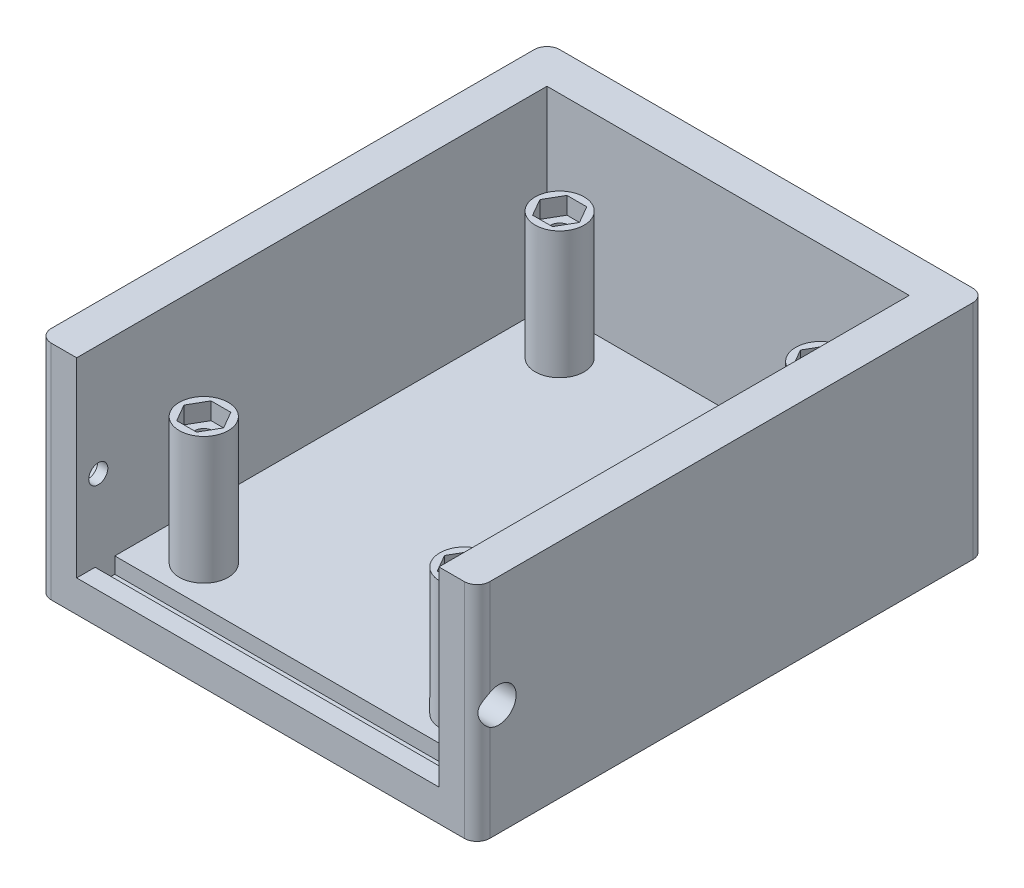
from build123d import *

# Parameters (mm, degrees)
SKETCH1_W                                = 65
SKETCH1_H                                = 80
BOSS_EXTRUDE1_DEPTH                      = 5
SKETCH2_W                                = 65
SKETCH2_H                                = 80
SKETCH2_W_2                              = 57
SKETCH2_H_2                              = 68
BOSS_EXTRUDE2_DEPTH                      = 30
SKETCH3_R                                = 3.85
BOSS_EXTRUDE3_DEPTH                      = 20
F_3_0MM_DOWEL_HOLE1_D                    = 3
F_3_0MM_DOWEL_HOLE1_DEPTH                = 8.5
F_3_0MM_DOWEL_HOLE1_CSINK_D              = 3.05
F_3_0MM_DOWEL_HOLE1_CSINK_ANGLE          = 90
F_3_0MM_DOWEL_HOLE1_TIP                  = 0.901290929
CUT_EXTRUDE1_DEPTH                       = 2.7
MIRROR1_AT_THE_SECOND_PLANE_COPY_1_DEPTH = 2.7
SKETCH13_R                               = 2.75
CUT_EXTRUDE4_DEPTH                       = 2.4
SKETCH14_R                               = 1.5
CUT_EXTRUDE5_DEPTH                       = 4
SKETCH11_W                               = 57
SKETCH11_H                               = 6
CUT_EXTRUDE2_DEPTH                       = 30
SKETCH15_W                               = 57
SKETCH15_H                               = 3.1
CUT_EXTRUDE6_DEPTH                       = 2.5
SKETCH16_W                               = 80
SKETCH16_H                               = 35
SKETCH16_R                               = 2.75
BOSS_EXTRUDE4_DEPTH                      = 2
FILLET1_R                                = 2


with BuildPart() as part:
    # Sketch1 → Boss-Extrude1 (new body)
    with BuildSketch(Plane(origin=(0, 0, 0), x_dir=(1, 0, 0), z_dir=(0, 1, 0))):
        Rectangle(SKETCH1_W, SKETCH1_H)
    extrude(amount=BOSS_EXTRUDE1_DEPTH)

    # Sketch2 → Boss-Extrude2 (add)
    with BuildSketch(Plane(origin=(0, 5, 0), x_dir=(1, 0, 0), z_dir=(0, 1, 0))):
        Rectangle(SKETCH2_W, SKETCH2_H)
        Rectangle(SKETCH2_W_2, SKETCH2_H_2, mode=Mode.SUBTRACT)
    extrude(amount=BOSS_EXTRUDE2_DEPTH)

    # Sketch3 → Boss-Extrude3 (add)
    with BuildSketch(Plane(origin=(0, 5, 0), x_dir=(1, 0, 0), z_dir=(0, 1, 0))):
        with Locations(Location((-20.5, -28, 0), (0, 0, 90))):
            Circle(SKETCH3_R)
        with Locations(Location((20.5, -28, 0), (0, 0, 90))):
            Circle(SKETCH3_R)
        with Locations(Location((20.5, 28, 0), (0, 0, 90))):
            Circle(SKETCH3_R)
        with Locations(Location((-20.5, 28, 0), (0, 0, 90))):
            Circle(SKETCH3_R)
    extrude(amount=BOSS_EXTRUDE3_DEPTH)

    # Ø3.0mm Dowel Hole1
    with Locations(Plane(origin=(0, 25, 0), x_dir=(1, 0, 0), z_dir=(0, 1, 0))):
        with Locations((-20.5, 28), (20.5, 28), (20.5, -28), (-20.5, -28)):
            CounterSinkHole(F_3_0MM_DOWEL_HOLE1_D / 2, F_3_0MM_DOWEL_HOLE1_CSINK_D / 2, depth=F_3_0MM_DOWEL_HOLE1_DEPTH, counter_sink_angle=F_3_0MM_DOWEL_HOLE1_CSINK_ANGLE)
            with Locations((0, 0, -(F_3_0MM_DOWEL_HOLE1_DEPTH + F_3_0MM_DOWEL_HOLE1_TIP / 2))):  # 118° drill point
                Cone(0, F_3_0MM_DOWEL_HOLE1_D / 2, F_3_0MM_DOWEL_HOLE1_TIP, mode=Mode.SUBTRACT)

    # Sketch8 → Cut-Extrude1 (cut)
    with BuildSketch(Plane(origin=(0, 25, 0), x_dir=(1, 0, 0), z_dir=(0, 1, 0))):
        Polygon((-17.382308546, 28), (-18.941154273, 30.7), (-22.058845727, 30.7), (-23.617691454, 28), (-22.058845727, 25.3), (-18.941154273, 25.3), align=None)
    cut_extrude1 = extrude(amount=-CUT_EXTRUDE1_DEPTH, mode=Mode.SUBTRACT)

    # Mirror1: Cut-Extrude1 across plane
    add(cut_extrude1.mirror(Plane.XY), mode=Mode.SUBTRACT)

    # Mirror1 at the second plane: Cut-Extrude1 across plane
    add(cut_extrude1.mirror(Plane(origin=(0, 0, 0), x_dir=(0, 0, 1), z_dir=(1, 0, 0))), mode=Mode.SUBTRACT)

    # Mirror1 at the second plane copy 1 sketc → Mirror1 at the second plane copy 1 (cut)
    with BuildSketch(Plane(origin=(0, 25, 0), x_dir=(-1, 0, 0), z_dir=(0, 1, 0))):
        Polygon((-17.382308546, 28), (-18.941154273, 30.7), (-22.058845727, 30.7), (-23.617691454, 28), (-22.058845727, 25.3), (-18.941154273, 25.3), align=None)
    extrude(amount=-MIRROR1_AT_THE_SECOND_PLANE_COPY_1_DEPTH, mode=Mode.SUBTRACT)

    # Sketch13 → Cut-Extrude4 (cut)
    with BuildSketch(Plane(origin=(32.5, 0, 0), x_dir=(0, 0, -1), z_dir=(1, 0, 0))):
        with Locations((-36.6, 17.5)):
            Circle(SKETCH13_R)
    cut_extrude4 = extrude(amount=-CUT_EXTRUDE4_DEPTH, mode=Mode.SUBTRACT)

    # Sketch14 → Cut-Extrude5 (cut)
    with BuildSketch(Plane(origin=(32.5, 0, 0), x_dir=(0, 0, -1), z_dir=(1, 0, 0))):
        with Locations((-36.6, 17.5)):
            Circle(SKETCH14_R)
    cut_extrude5 = extrude(amount=-CUT_EXTRUDE5_DEPTH, mode=Mode.SUBTRACT)

    # Mirror2: Cut-Extrude4, Cut-Extrude5 across plane
    add(cut_extrude4.mirror(Plane(origin=(0, 0, 0), x_dir=(0, 0, 1), z_dir=(1, 0, 0))), mode=Mode.SUBTRACT)
    add(cut_extrude5.mirror(Plane(origin=(0, 0, 0), x_dir=(0, 0, 1), z_dir=(1, 0, 0))), mode=Mode.SUBTRACT)

    # Sketch11 → Cut-Extrude2 (cut)
    with BuildSketch(Plane(origin=(0, 35, 0), x_dir=(1, 0, 0), z_dir=(0, 1, 0))):
        with Locations((0, -37)):
            Rectangle(SKETCH11_W, SKETCH11_H)
    extrude(amount=-CUT_EXTRUDE2_DEPTH, mode=Mode.SUBTRACT)

    # Sketch15 → Cut-Extrude6 (cut)
    with BuildSketch(Plane(origin=(0, 5, 0), x_dir=(1, 0, 0), z_dir=(0, 1, 0))):
        with Locations((0, -35.55)):
            Rectangle(SKETCH15_W, SKETCH15_H)
    extrude(amount=-CUT_EXTRUDE6_DEPTH, mode=Mode.SUBTRACT)

    # Sketch16 → Boss-Extrude4 (add)
    with BuildSketch(Plane.ZY.offset(32.5)):
        with Locations((0, 17.5)):
            Rectangle(SKETCH16_W, SKETCH16_H)
        with Locations(Location((36.6, 17.5, 0), (0, 0, 180))):
            Circle(SKETCH16_R, mode=Mode.SUBTRACT)
    boss_extrude4 = extrude(amount=BOSS_EXTRUDE4_DEPTH)

    # Mirror3: Boss-Extrude4 across plane
    add(boss_extrude4.mirror(Plane(origin=(0, 0, 0), x_dir=(0, 0, 1), z_dir=(1, 0, 0))))

    # Fillet1
    # the kernel refuses this fillet: 2 mm, written as the material it takes off along each edge
    with BuildSketch(Plane(origin=(-34.5, -5, -40), x_dir=(1, 0, 0), z_dir=(0, 1, 0)), Plane(origin=(-34.5, 40, 40), x_dir=(1, 0, 0), z_dir=(0, -1, 0)), Plane(origin=(34.5, -5, -40), x_dir=(0, 0, 1), z_dir=(0, 1, 0))) as fillet1_piece_1:
        with BuildLine():
            CenterArc((FILLET1_R, -FILLET1_R), FILLET1_R, 90, 90)
            Line((0, -FILLET1_R), (0, 0))
            Line((0, 0), (FILLET1_R, 0))
        make_face()
    extrude(amount=45, mode=Mode.SUBTRACT)
    with BuildSketch(Plane(origin=(34.5, 40, 40), x_dir=(-1, 0, 0), z_dir=(0, -1, 0))) as fillet1_piece_2:
        with BuildLine():
            CenterArc((FILLET1_R, FILLET1_R), FILLET1_R, 180, 90)
            Line((0, FILLET1_R), (0, 0))
            Line((0, 0), (FILLET1_R, 0))
        make_face()
    extrude(amount=45, mode=Mode.SUBTRACT)


solid = part.part
